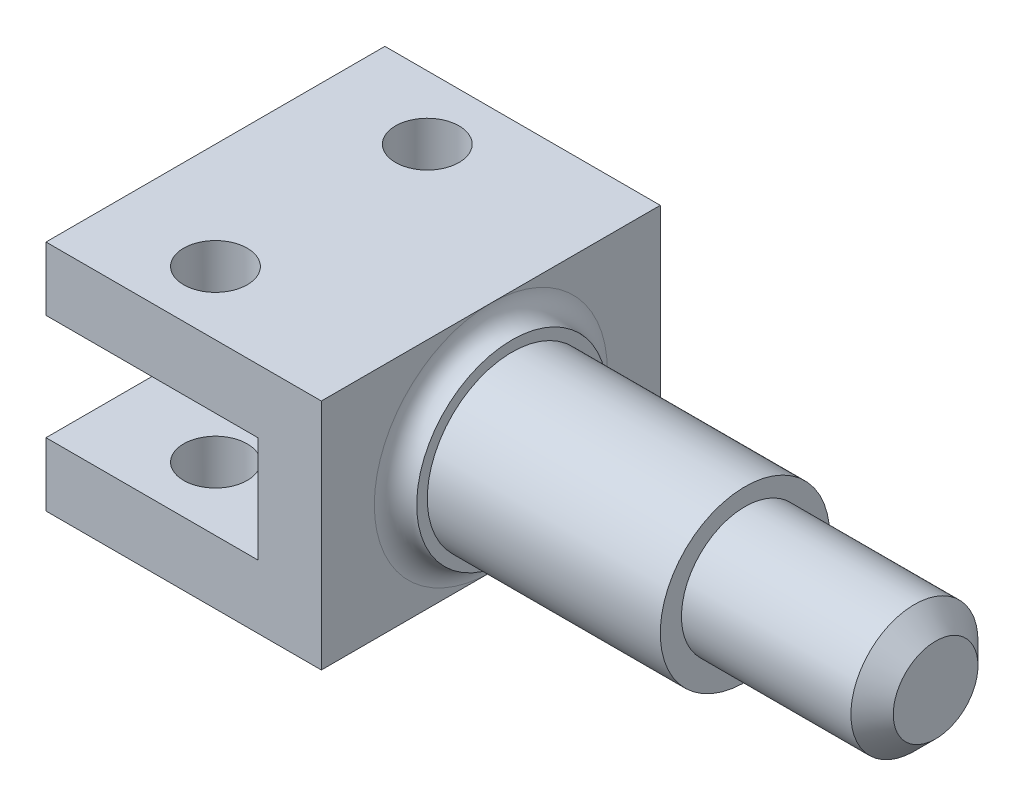
from build123d import *

# Parameters (mm, degrees)
EXTRUDE_1_DEPTH     = 16
SKETCH_2_R          = 1.5
CUT_EXTRUDE_1_DEPTH = 16
SKETCH_3_R          = 4.5
EXTRUDE_2_DEPTH     = 1
FILLET_1_R          = 1
SKETCH_4_R          = 4
EXTRUDE_3_DEPTH     = 11
SKETCH_5_R          = 3
EXTRUDE_4_DEPTH     = 9
CHAMFER_1_SIZE      = 1


with BuildPart() as part:
    # 草图1 → 凸台-拉伸1 (new body)
    with BuildSketch(Plane.XY):
        Polygon((0, 0), (13, 0), (13, 11), (0, 11), (0, 8), (10, 8), (10, 3), (0, 3), align=None)
    extrude(amount=EXTRUDE_1_DEPTH)

    # 草图2 → 切除-拉伸1 (cut)
    with BuildSketch(Plane(origin=(0, 11, 0), x_dir=(1, 0, 0), z_dir=(0, 1, 0))):
        with Locations(Location((5, -3, 0), (0, 0, 270))):
            Circle(SKETCH_2_R)
        with Locations(Location((5, -13, 0), (0, 0, 270))):
            Circle(SKETCH_2_R)
    extrude(amount=-CUT_EXTRUDE_1_DEPTH, mode=Mode.SUBTRACT)

    # 草图3 → 凸台-拉伸2 (add)
    with BuildSketch(Plane(origin=(13, 0, 0), x_dir=(0, 0, -1), z_dir=(1, 0, 0))):
        with Locations((-8, 5.5)):
            Circle(SKETCH_3_R)
    extrude(amount=EXTRUDE_2_DEPTH)

    # 圆角1
    fillet_1_edges = [part.edges().sort_by_distance(p)[0] for p in [
        (13, 5.5, 12.5),
    ]]
    fillet(fillet_1_edges, radius=FILLET_1_R - 0.0001)  # a hair under: the kernel refuses the full size

    # 草图4 → 凸台-拉伸3 (add)
    with BuildSketch(Plane(origin=(14, 0, 0), x_dir=(0, 0, -1), z_dir=(1, 0, 0))):
        with Locations((-8, 5.5)):
            Circle(SKETCH_4_R)
    extrude(amount=EXTRUDE_3_DEPTH)

    # 草图5 → 凸台-拉伸4 (add)
    with BuildSketch(Plane(origin=(25, 0, 0), x_dir=(0, 0, -1), z_dir=(1, 0, 0))):
        with Locations((-8, 5.683281664)):
            Circle(SKETCH_5_R)
    extrude(amount=EXTRUDE_4_DEPTH)

    # 倒角1
    chamfer_1_edges = [part.edges().sort_by_distance(p)[0] for p in [
        (34, 5.683281664, 11),
    ]]
    chamfer(chamfer_1_edges, length=CHAMFER_1_SIZE)


solid = part.part
